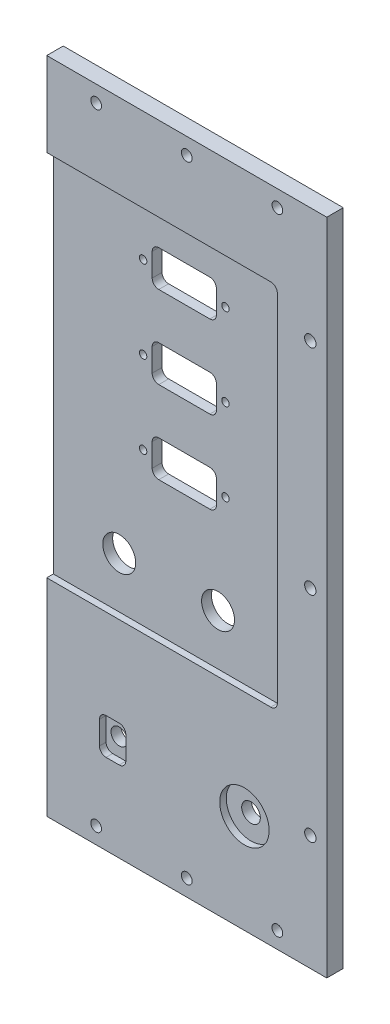
from build123d import *

# Parameters (mm, degrees)
SKETCH1_W                                           = 85
SKETCH1_H                                           = 200
BOSS_EXTRUDE1_DEPTH                                 = 5
SKETCH2_3_R                                         = 2.5
LED_THRU_HOLE_DEPTH                                 = 5
F_1_4_40_THREADED_THROUGH_HOLE_REACH                = 193.839
SKETCH3_R                                           = 2.82956
CBORE_FOR_4_BINDING_HEAD_MACHINE_SCREW1_D           = 3.4544
CBORE_FOR_4_BINDING_HEAD_MACHINE_SCREW1_CBORE_D     = 6.74624
CBORE_FOR_4_BINDING_HEAD_MACHINE_SCREW1_CBORE_DEPTH = 1.7272
SKETCH2_7_W                                         = 19.5
SKETCH2_7_H                                         = 11
RS232_FEEDTHRUS_DEPTH                               = 5
ELECTRONICS_START                                   = 3
ELECTRONICS_RECESS_OUTLINE_W                        = 70
ELECTRONICS_RECESS_OUTLINE_H                        = 111.786888031
ELECTRONICS_RECESS_OUTLINE_R                        = 5
ELECTRONICS_RECESS_OUTLINE_W_2                      = 19.5
ELECTRONICS_RECESS_OUTLINE_H_2                      = 11
ELECTRONICS_RECESS_OUTLINE_W_3                      = 8
ELECTRONICS_RECESS_OUTLINE_R_2                      = 2.5
ELECTRONICS_RECESS_DEPTH                            = 2
FILLET4_R                                           = 2
CBORE_FOR_4_BINDING_HEAD_MACHINE_SCREW2_D           = 3.2639
CBORE_FOR_4_BINDING_HEAD_MACHINE_SCREW2_CBORE_D     = 6.74624
CBORE_FOR_4_BINDING_HEAD_MACHINE_SCREW2_CBORE_DEPTH = 1.7272
F_4_40_TAPPED_HOLE1_D                               = 2.2606
F_4_40_TAPPED_HOLE1_DEPTH                           = 7.6
F_4_40_TAPPED_HOLE1_TIP                             = 0.679152758
F_4_40_TAPPED_HOLE3_D                               = 2.2606
SKETCH3_4_R                                         = 7.5
SKETCH3_4_R_2                                       = 2.82956
CUT_EXTRUDE1_DEPTH                                  = 2
SKETCH2_11_R                                        = 5
CUT_EXTRUDE2_DEPTH                                  = 192.838916346


# Read off the part's stored shape, not the designer's step: electronics recess
with BuildPart() as part:
    # Sketch1 → Boss-Extrude1 (new body)
    with BuildSketch(Plane.XY):
        with Locations((-115.863171355, -8.158567775)):
            Rectangle(SKETCH1_W, SKETCH1_H)
    extrude(amount=BOSS_EXTRUDE1_DEPTH)

    # Sketch2<3> (on Front Plane) → LED thru hole (cut)
    with BuildSketch(Plane.XY):
        with Locations((-138.363171355, -78.158567775)):
            Circle(SKETCH2_3_R)
    extrude(amount=LED_THRU_HOLE_DEPTH, mode=Mode.SUBTRACT)

    # Sketch3 → 1/4-40 threaded through hole (cut, up to next)
    with BuildSketch(Plane.XY.offset(5), mode=Mode.PRIVATE) as f_1_4_40_threaded_through_hole_sk1:
        with Locations((-98.363171355, -78.158567775)):
            Circle(SKETCH3_R)
    f_1_4_40_threaded_through_hole_tool1 = extrude(f_1_4_40_threaded_through_hole_sk1.sketch, amount=-F_1_4_40_THREADED_THROUGH_HOLE_REACH, mode=Mode.PRIVATE) & part.part
    add(f_1_4_40_threaded_through_hole_tool1.solids().sort_by_distance((-98.363171, -78.158568, 5))[0], mode=Mode.SUBTRACT)

    # CBORE for #4 Binding Head Machine Screw1 (through all)
    with Locations(Plane(origin=(0, 0, 0), x_dir=(-1, 0, 0), z_dir=(0, 0, -1))):
        with Locations((78.363171355, 56.841432225), (78.363171355, -8.158567775), (78.363171355, -73.158567775)):
            CounterBoreHole(CBORE_FOR_4_BINDING_HEAD_MACHINE_SCREW1_D / 2, CBORE_FOR_4_BINDING_HEAD_MACHINE_SCREW1_CBORE_D / 2, CBORE_FOR_4_BINDING_HEAD_MACHINE_SCREW1_CBORE_DEPTH)

    # Sketch2<7> (on Front Plane) → RS232 feedthrus (cut)
    with BuildSketch(Plane.XY):
        with Locations((-118.613171355, 50.841432225)):
            Rectangle(SKETCH2_7_W, SKETCH2_7_H)
        with Locations((-118.613171355, 25.841432225)):
            Rectangle(SKETCH2_7_W, SKETCH2_7_H)
        with Locations((-118.613171355, 0.841432225)):
            Rectangle(SKETCH2_7_W, SKETCH2_7_H)
    extrude(amount=RS232_FEEDTHRUS_DEPTH, mode=Mode.SUBTRACT)

    # electronics recess outline → electronics recess (cut)
    # profile 1 of 2: a face of its own
    with BuildSketch(Plane.XY.offset(ELECTRONICS_START)):
        with Locations((-123.363171355, 10.44798821)):
            Rectangle(ELECTRONICS_RECESS_OUTLINE_W, ELECTRONICS_RECESS_OUTLINE_H)
        with Locations((-138.363171355, -30.052011791)):
            Circle(ELECTRONICS_RECESS_OUTLINE_R, mode=Mode.SUBTRACT)
        with Locations((-108.363171355, -30.052011791)):
            Circle(ELECTRONICS_RECESS_OUTLINE_R, mode=Mode.SUBTRACT)
        with Locations((-118.613171355, 0.841432225)):
            Rectangle(ELECTRONICS_RECESS_OUTLINE_W_2, ELECTRONICS_RECESS_OUTLINE_H_2, mode=Mode.SUBTRACT)
        with Locations((-118.613171355, 25.841432225)):
            Rectangle(ELECTRONICS_RECESS_OUTLINE_W_2, ELECTRONICS_RECESS_OUTLINE_H_2, mode=Mode.SUBTRACT)
        with Locations((-118.613171355, 50.841432225)):
            Rectangle(ELECTRONICS_RECESS_OUTLINE_W_2, ELECTRONICS_RECESS_OUTLINE_H_2, mode=Mode.SUBTRACT)
    # profile 2 of 2: a face of its own
    with BuildSketch(Plane.XY.offset(ELECTRONICS_START)):
        with Locations((-138.363171355, -78.158567775)):
            Rectangle(ELECTRONICS_RECESS_OUTLINE_W_3, ELECTRONICS_RECESS_OUTLINE_H_2)
        with Locations((-138.363171355, -78.158567775)):
            Circle(ELECTRONICS_RECESS_OUTLINE_R_2, mode=Mode.SUBTRACT)
    extrude(amount=ELECTRONICS_RECESS_DEPTH, mode=Mode.SUBTRACT)

    # Fillet4
    fillet4_edges = [part.edges().sort_by_distance(p)[0] for p in [
        (-134.363171355, -83.658567775, 4),
        (-142.363171355, -83.658567775, 4),
        (-142.363171355, -72.658567775, 4),
        (-134.363171355, -72.658567775, 4),
        (-88.363171355, -45.445455806, 4),
        (-88.363171355, 66.341432225, 4),
        (-128.363171355, 45.341432225, 1.5),
        (-128.363171355, 56.341432225, 1.5),
        (-108.863171355, 56.341432225, 1.5),
        (-108.863171355, 45.341432225, 1.5),
        (-128.363171355, 20.341432225, 1.5),
        (-128.363171355, 31.341432225, 1.5),
        (-108.863171355, 31.341432225, 1.5),
        (-108.863171355, 20.341432225, 1.5),
        (-108.863171355, 6.341432225, 1.5),
        (-108.863171355, -4.658567775, 1.5),
        (-128.363171355, -4.658567775, 1.5),
        (-128.363171355, 6.341432225, 1.5),
    ]]
    fillet(fillet4_edges, radius=FILLET4_R)

    # CBORE for #4 Binding Head Machine Screw2 (through all)
    with Locations(Plane(origin=(0, 0, 0), x_dir=(-1, 0, 0), z_dir=(0, 0, -1))):
        with Locations((143.363171355, 86.841432225), (115.863171355, 86.841432225), (88.363171355, 86.841432225), (88.363171355, -103.158567775), (115.863171355, -103.158567775), (143.363171355, -103.158567775)):
            CounterBoreHole(CBORE_FOR_4_BINDING_HEAD_MACHINE_SCREW2_D / 2, CBORE_FOR_4_BINDING_HEAD_MACHINE_SCREW2_CBORE_D / 2, CBORE_FOR_4_BINDING_HEAD_MACHINE_SCREW2_CBORE_DEPTH)

    # #4-40 Tapped Hole1
    with Locations(Plane.ZY.offset(158.363171355)):
        with Locations((2.5, -58.158567775)):
            Hole(F_4_40_TAPPED_HOLE1_D / 2, depth=F_4_40_TAPPED_HOLE1_DEPTH)
            with Locations((0, 0, -(F_4_40_TAPPED_HOLE1_DEPTH + F_4_40_TAPPED_HOLE1_TIP / 2))):  # 118° drill point
                Cone(0, F_4_40_TAPPED_HOLE1_D / 2, F_4_40_TAPPED_HOLE1_TIP, mode=Mode.SUBTRACT)

    # #4-40 Tapped Hole3 (through all)
    with Locations(Plane.XY.offset(3)):
        with Locations((-131.113171355, 50.841432225), (-106.113171355, 50.841432225), (-106.113171355, 25.841432225), (-131.113171355, 25.841432225), (-131.113171355, 0.841432225), (-106.113171355, 0.841432225)):
            Hole(F_4_40_TAPPED_HOLE3_D / 2)

    # Sketch3<4> → Cut-Extrude1 (cut)
    with BuildSketch(Plane.XY.offset(5)):
        with Locations((-98.363171355, -78.158567775)):
            Circle(SKETCH3_4_R)
        with Locations((-98.363171355, -78.158567775)):
            Circle(SKETCH3_4_R_2, mode=Mode.SUBTRACT)
    extrude(amount=-CUT_EXTRUDE1_DEPTH, mode=Mode.SUBTRACT)

    # Sketch2<11> (on Front Plane) → Cut-Extrude2 (cut, through all)
    with BuildSketch(Plane.XY):
        with Locations((-138.363171355, -30.052011791)):
            Circle(SKETCH2_11_R)
        with Locations((-108.363171355, -30.052011791)):
            Circle(SKETCH2_11_R)
    extrude(amount=CUT_EXTRUDE2_DEPTH, mode=Mode.SUBTRACT)


solid = part.part
